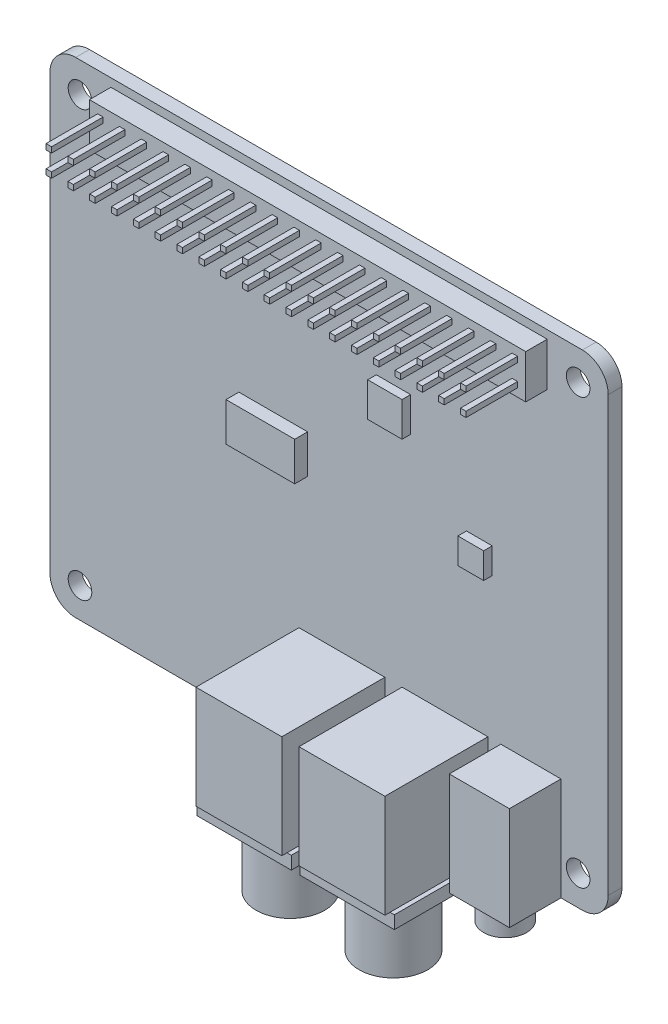
from build123d import *

# Parameters (mm, degrees)
PCB_DEPTH              = 1.6
SKETCH2_W              = 50.8
SKETCH2_H              = 5.08
HEADER_BLOCK_DEPTH     = 2.5
SKETCH3_W              = 0.64
SKETCH3_H              = 0.64
HEADER_PINS_DEPTH      = 6
SKETCH4_W              = 8
SKETCH4_H              = 4.5
IC_DAC_DEPTH           = 1.5
SKETCH5_W              = 4
SKETCH5_H              = 4
SKETCH5_W_2            = 3
SKETCH5_H_2            = 3
IC_SMALL_DEPTH         = 1
SKETCH6_W              = 10
SKETCH6_H              = 12
RCA_HOUSINGS_DEPTH     = 12
SKETCH7_W              = 11
SKETCH7_H              = 12
RCA_FLANGES_DEPTH      = 1.5
SKETCH8_R              = 4
RCA_BARRELS_DEPTH      = 9
SKETCH9_W              = 7
SKETCH9_H              = 12
JACK_BODY_DEPTH        = 6
SKETCH10_R             = 2.5
JACK_NOSE_DEPTH        = 2.5
SKETCH11_R             = 2.5
RCA_BORES_DEPTH        = 9
SKETCH12_R             = 1.75
JACK_BORE_DEPTH        = 2.5
MOUNT_HOLES_DEPTH      = 88.190653169
MOUNT_HOLES_DEPTH_BACK = 88.190653169
SKETCH13_R             = 1.375


with BuildPart() as part:
    # Sketch1 → PCB (new body)
    with BuildSketch(Plane.XY):
        with BuildLine():
            Line((3, 0), (62, 0))
            ThreePointArc((62, 0), (64.121320344, 0.878679656), (65, 3))
            Line((65, 3), (65, 53.5))
            ThreePointArc((65, 53.5), (64.121320344, 55.621320344), (62, 56.5))
            Line((62, 56.5), (3, 56.5))
            ThreePointArc((3, 56.5), (0.878679656, 55.621320344), (0, 53.5))
            Line((0, 53.5), (0, 3))
            ThreePointArc((0, 3), (0.878679656, 0.878679656), (3, 0))
        make_face()
    extrude(amount=PCB_DEPTH)

    # Sketch2 → Header_Block (add)
    with BuildSketch(Plane.XY.offset(1.6)):
        with Locations((32.5, 53)):
            Rectangle(SKETCH2_W, SKETCH2_H)
    extrude(amount=HEADER_BLOCK_DEPTH)

    # Sketch3 → Header_Pins (add)
    with BuildSketch(Plane.XY.offset(4.1)):
        with Locations((8.37, 51.73)):
            Rectangle(SKETCH3_W, SKETCH3_H)
        with Locations((8.37, 54.27)):
            Rectangle(SKETCH3_W, SKETCH3_H)
        with Locations((10.91, 51.73)):
            Rectangle(SKETCH3_W, SKETCH3_H)
        with Locations((10.91, 54.27)):
            Rectangle(SKETCH3_W, SKETCH3_H)
        with Locations((13.45, 51.73)):
            Rectangle(SKETCH3_W, SKETCH3_H)
        with Locations((13.45, 54.27)):
            Rectangle(SKETCH3_W, SKETCH3_H)
        with Locations((15.99, 51.73)):
            Rectangle(SKETCH3_W, SKETCH3_H)
        with Locations((15.99, 54.27)):
            Rectangle(SKETCH3_W, SKETCH3_H)
        with Locations((18.53, 51.73)):
            Rectangle(SKETCH3_W, SKETCH3_H)
        with Locations((18.53, 54.27)):
            Rectangle(SKETCH3_W, SKETCH3_H)
        with Locations((21.07, 51.73)):
            Rectangle(SKETCH3_W, SKETCH3_H)
        with Locations((21.07, 54.27)):
            Rectangle(SKETCH3_W, SKETCH3_H)
        with Locations((23.61, 51.73)):
            Rectangle(SKETCH3_W, SKETCH3_H)
        with Locations((23.61, 54.27)):
            Rectangle(SKETCH3_W, SKETCH3_H)
        with Locations((26.15, 51.73)):
            Rectangle(SKETCH3_W, SKETCH3_H)
        with Locations((26.15, 54.27)):
            Rectangle(SKETCH3_W, SKETCH3_H)
        with Locations((28.69, 51.73)):
            Rectangle(SKETCH3_W, SKETCH3_H)
        with Locations((28.69, 54.27)):
            Rectangle(SKETCH3_W, SKETCH3_H)
        with Locations((31.23, 51.73)):
            Rectangle(SKETCH3_W, SKETCH3_H)
        with Locations((31.23, 54.27)):
            Rectangle(SKETCH3_W, SKETCH3_H)
        with Locations((33.77, 51.73)):
            Rectangle(SKETCH3_W, SKETCH3_H)
        with Locations((33.77, 54.27)):
            Rectangle(SKETCH3_W, SKETCH3_H)
        with Locations((36.31, 51.73)):
            Rectangle(SKETCH3_W, SKETCH3_H)
        with Locations((36.31, 54.27)):
            Rectangle(SKETCH3_W, SKETCH3_H)
        with Locations((38.85, 51.73)):
            Rectangle(SKETCH3_W, SKETCH3_H)
        with Locations((38.85, 54.27)):
            Rectangle(SKETCH3_W, SKETCH3_H)
        with Locations((41.39, 51.73)):
            Rectangle(SKETCH3_W, SKETCH3_H)
        with Locations((41.39, 54.27)):
            Rectangle(SKETCH3_W, SKETCH3_H)
        with Locations((43.93, 51.73)):
            Rectangle(SKETCH3_W, SKETCH3_H)
        with Locations((43.93, 54.27)):
            Rectangle(SKETCH3_W, SKETCH3_H)
        with Locations((46.47, 51.73)):
            Rectangle(SKETCH3_W, SKETCH3_H)
        with Locations((46.47, 54.27)):
            Rectangle(SKETCH3_W, SKETCH3_H)
        with Locations((49.01, 51.73)):
            Rectangle(SKETCH3_W, SKETCH3_H)
        with Locations((49.01, 54.27)):
            Rectangle(SKETCH3_W, SKETCH3_H)
        with Locations((51.55, 51.73)):
            Rectangle(SKETCH3_W, SKETCH3_H)
        with Locations((51.55, 54.27)):
            Rectangle(SKETCH3_W, SKETCH3_H)
        with Locations((54.09, 51.73)):
            Rectangle(SKETCH3_W, SKETCH3_H)
        with Locations((54.09, 54.27)):
            Rectangle(SKETCH3_W, SKETCH3_H)
        with Locations((56.63, 51.73)):
            Rectangle(SKETCH3_W, SKETCH3_H)
        with Locations((56.63, 54.27)):
            Rectangle(SKETCH3_W, SKETCH3_H)
    extrude(amount=HEADER_PINS_DEPTH)

    # Sketch4 → IC_DAC (add)
    with BuildSketch(Plane.XY.offset(1.6)):
        with Locations((26, 30)):
            Rectangle(SKETCH4_W, SKETCH4_H)
    extrude(amount=IC_DAC_DEPTH)

    # Sketch5 → IC_Small (add)
    with BuildSketch(Plane.XY.offset(1.6)):
        with Locations((40, 40)):
            Rectangle(SKETCH5_W, SKETCH5_H)
        with Locations((50, 30)):
            Rectangle(SKETCH5_W_2, SKETCH5_H_2)
    extrude(amount=IC_SMALL_DEPTH)

    # Sketch6 → RCA_Housings (add)
    with BuildSketch(Plane.XY.offset(1.6)):
        with Locations((34, 6)):
            Rectangle(SKETCH6_W, SKETCH6_H)
        with Locations((46, 6)):
            Rectangle(SKETCH6_W, SKETCH6_H)
    extrude(amount=RCA_HOUSINGS_DEPTH)

    # Sketch7 → RCA_Flanges (add)
    with BuildSketch(Plane(origin=(0, 0, 0), x_dir=(1, 0, 0), z_dir=(0, 1, 0))):
        with Locations((34, -7)):
            Rectangle(SKETCH7_W, SKETCH7_H)
        with Locations((46, -7)):
            Rectangle(SKETCH7_W, SKETCH7_H)
    extrude(amount=-RCA_FLANGES_DEPTH)

    # Sketch8 → RCA_Barrels (add)
    with BuildSketch(Plane(origin=(0, 0, 0), x_dir=(1, 0, 0), z_dir=(0, 1, 0))):
        with Locations((34, -7.6)):
            Circle(SKETCH8_R)
        with Locations((46, -7.6)):
            Circle(SKETCH8_R)
    extrude(amount=-RCA_BARRELS_DEPTH)

    # Sketch9 → Jack_Body (add)
    with BuildSketch(Plane.XY.offset(1.6)):
        with Locations((56, 6)):
            Rectangle(SKETCH9_W, SKETCH9_H)
    extrude(amount=JACK_BODY_DEPTH)

    # Sketch10 → Jack_Nose (add)
    with BuildSketch(Plane(origin=(0, 0, 0), x_dir=(1, 0, 0), z_dir=(0, 1, 0))):
        with Locations((56, -4.6)):
            Circle(SKETCH10_R)
    extrude(amount=-JACK_NOSE_DEPTH)

    # Sketch11 → RCA_Bores (cut)
    with BuildSketch(Plane(origin=(0, 0, 0), x_dir=(1, 0, 0), z_dir=(0, 1, 0))):
        with Locations((34, -7.6)):
            Circle(SKETCH11_R)
        with Locations((46, -7.6)):
            Circle(SKETCH11_R)
    extrude(amount=RCA_BORES_DEPTH, mode=Mode.SUBTRACT)

    # Sketch12 → Jack_Bore (cut)
    with BuildSketch(Plane(origin=(0, 0, 0), x_dir=(1, 0, 0), z_dir=(0, 1, 0))):
        with Locations((56, -4.6)):
            Circle(SKETCH12_R)
    extrude(amount=JACK_BORE_DEPTH, mode=Mode.SUBTRACT)

    # Sketch13 → Mount_Holes (cut, two sides: drawn at the far end of the back side and taken through both)
    with BuildSketch(Plane.XY.offset(-MOUNT_HOLES_DEPTH_BACK)):
        with Locations((3.5, 3.5)):
            Circle(SKETCH13_R)
        with Locations((3.5, 53)):
            Circle(SKETCH13_R)
        with Locations((61.5, 3.5)):
            Circle(SKETCH13_R)
        with Locations((61.5, 53)):
            Circle(SKETCH13_R)
    extrude(amount=MOUNT_HOLES_DEPTH + MOUNT_HOLES_DEPTH_BACK, mode=Mode.SUBTRACT)


solid = part.part
